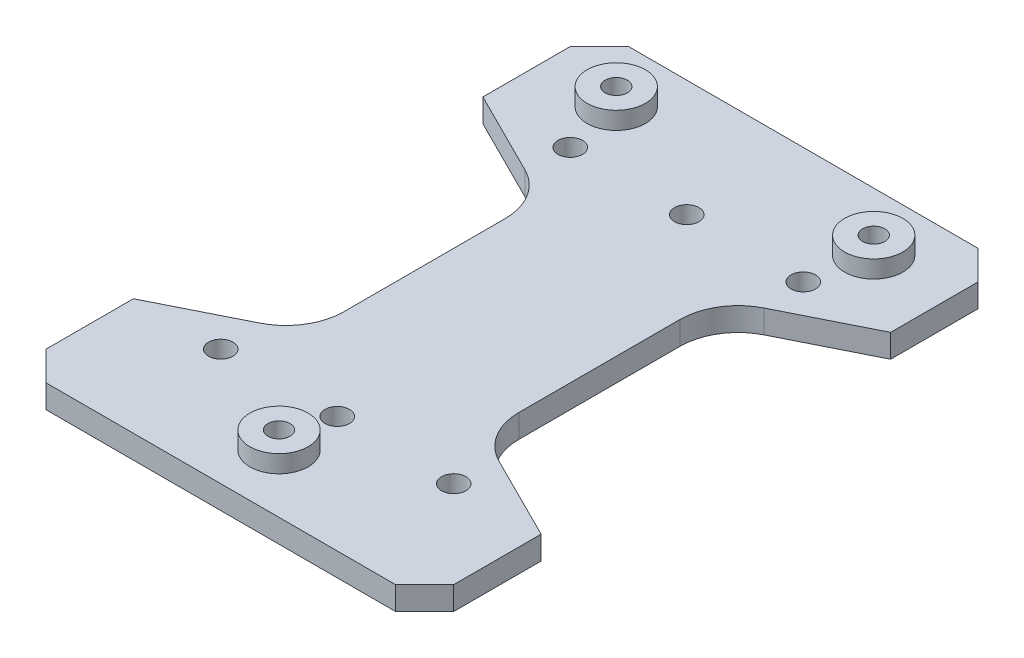
from build123d import *

# Parameters (mm, degrees)
SKETCH_1_W                  = 70
SKETCH_1_H                  = 100
EXTRUDE_1_DEPTH             = 4
SKETCH_2_R                  = 5
EXTRUDE_2_DEPTH             = 3
SKETCH_3_R                  = 1.9
CUT_EXTRUDE_1_DEPTH         = 4
SKETCH_6_R                  = 2.1
CUT_EXTRUDE_4_DEPTH         = 62.163714733
PATTERN_LINEAR_1_COUNT      = 3
PATTERN_LINEAR_1_PITCH      = 20
PATTERN_LINEAR_1_COUNT_DIR2 = 4
PATTERN_LINEAR_1_PITCH_DIR2 = 20
CUT_EXTRUDE_5_DEPTH         = 62.163714733
CHAMFER_1_SIZE              = 5
FILLET_1_R                  = 10


with BuildPart() as part:
    # 草圖1 → 填料-伸長1 (new body)
    with BuildSketch(Plane(origin=(0, 0, 0), x_dir=(1, 0, 0), z_dir=(0, 1, 0))):
        Rectangle(SKETCH_1_W, SKETCH_1_H)
    extrude(amount=EXTRUDE_1_DEPTH)

    # 草圖2 → 填料-伸長2 (add)
    with BuildSketch(Plane(origin=(0, 4, 0), x_dir=(1, 0, 0), z_dir=(0, 1, 0))):
        with Locations((-22.1, 40)):
            Circle(SKETCH_2_R)
        with Locations((22.1, 40)):
            Circle(SKETCH_2_R)
        with Locations((0, -40)):
            Circle(SKETCH_2_R)
    extrude(amount=EXTRUDE_2_DEPTH)

    # 草圖3 → 除料-伸長1 (cut)
    with BuildSketch(Plane(origin=(0, 7, 0), x_dir=(1, 0, 0), z_dir=(0, 1, 0))):
        with Locations((-22.1, 40)):
            Circle(SKETCH_3_R)
        with Locations((22.1, 40)):
            Circle(SKETCH_3_R)
        with Locations((0, -40)):
            Circle(SKETCH_3_R)
    extrude(amount=-CUT_EXTRUDE_1_DEPTH, mode=Mode.SUBTRACT)

    # 草圖6 → 除料-伸長4 (cut, through all)
    with BuildSketch(Plane(origin=(0, 4, 0), x_dir=(1, 0, 0), z_dir=(0, 1, 0))):
        with Locations((-20, 30)):
            Circle(SKETCH_6_R)
    cut_extrude_4 = extrude(amount=-CUT_EXTRUDE_4_DEPTH, mode=Mode.SUBTRACT)

    # 直線複製排列1: Cut-Extrude 4 3 × 4, 6 skipped
    with Locations(*[(i * PATTERN_LINEAR_1_PITCH, 0, j * PATTERN_LINEAR_1_PITCH_DIR2) for i in range(PATTERN_LINEAR_1_COUNT) for j in range(PATTERN_LINEAR_1_COUNT_DIR2) if (i, j) not in ((0, 0), (0, 1), (0, 2), (1, 1), (1, 2), (2, 1), (2, 2))]):
        add(cut_extrude_4, mode=Mode.SUBTRACT)

    # 草圖7 → 除料-伸長5 (cut, symmetric)
    with BuildSketch(Plane(origin=(0, 4, 0), x_dir=(1, 0, 0), z_dir=(0, 1, 0))):
        Polygon((-35, 30), (-15, 20), (-15, -20), (-35, -30), align=None)
    cut_extrude_5 = extrude(amount=CUT_EXTRUDE_5_DEPTH, both=True, mode=Mode.SUBTRACT)

    # 鏡射1: 除料-伸長5 across plane
    add(cut_extrude_5.mirror(Plane(origin=(0, 0, 0), x_dir=(0, 0, 1), z_dir=(1, 0, 0))), mode=Mode.SUBTRACT)

    # 導角1
    chamfer_1_edges = [part.edges().sort_by_distance(p)[0] for p in [
        (35, 2, -50),
        (-35, 2, -50),
        (35, 2, 50),
        (-35, 2, 50),
    ]]
    chamfer(chamfer_1_edges, length=CHAMFER_1_SIZE)

    # 圓角1
    fillet_1_edges = [part.edges().sort_by_distance(p)[0] for p in [
        (15, 2, -20),
        (15, 2, 20),
        (-15, 2, 20),
        (-15, 2, -20),
    ]]
    fillet(fillet_1_edges, radius=FILLET_1_R)


solid = part.part
